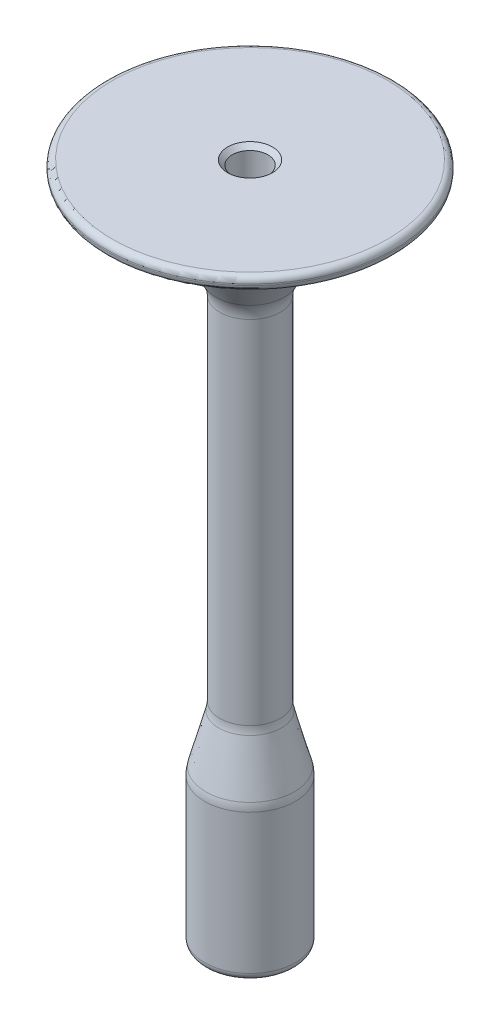
from build123d import *

# Parameters (mm, degrees)
CHAMFER1_SIZE = 0.762
FILLET1_R     = 1.27
FILLET2_R     = 1.016
FILLET3_R     = 5.08


with BuildPart() as part:
    # Sketch1 → Revolve1 (revolve)
    with BuildSketch(Plane.XY, mode=Mode.PRIVATE) as revolve1_sk:
        Polygon((-5.08, 96.012), (-5.08, 34.879409051), (-7.62, 25.4), (-7.62, 0), (-5.08, 0), (-5.08, 22.86), (0, 22.86), (0, 105.3), (-3, 105.3), (-3, 114.3), (-24.13, 114.3), (-24.13, 112.268), (-12.696662511, 109.204446453), align=None)
    revolve(revolve1_sk.sketch.rotate(Axis((0, 22.86, 0), (0, 1, 0)), 270), axis=Axis((0, 22.86, 0), (0, 1, 0)))

    # Chamfer1
    chamfer1_edges = [part.edges().sort_by_distance(p)[0] for p in [
        (0, 114.3, 3),
    ]]
    chamfer(chamfer1_edges, length=CHAMFER1_SIZE)

    # Fillet1
    fillet1_edges = [part.edges().sort_by_distance(p)[0] for p in [
        (0, 0, 5.08),
        (0, 0, 7.62),
    ]]
    fillet(fillet1_edges, radius=FILLET1_R - 0.0001)  # a hair under: the kernel refuses the full size

    # Fillet2
    fillet2_edges = [part.edges().sort_by_distance(p)[0] for p in [
        (0, 112.268, 24.13),
        (0, 114.3, 24.13),
    ]]
    fillet(fillet2_edges, radius=FILLET2_R)

    # Fillet3
    fillet3_edges = [part.edges().sort_by_distance(p)[0] for p in [
        (0, 109.204446453, 12.696662511),
        (0, 25.4, 7.62),
        (0, 34.879409051, 5.08),
        (0, 96.012, 5.08),
    ]]
    fillet(fillet3_edges, radius=FILLET3_R)


solid = part.part
